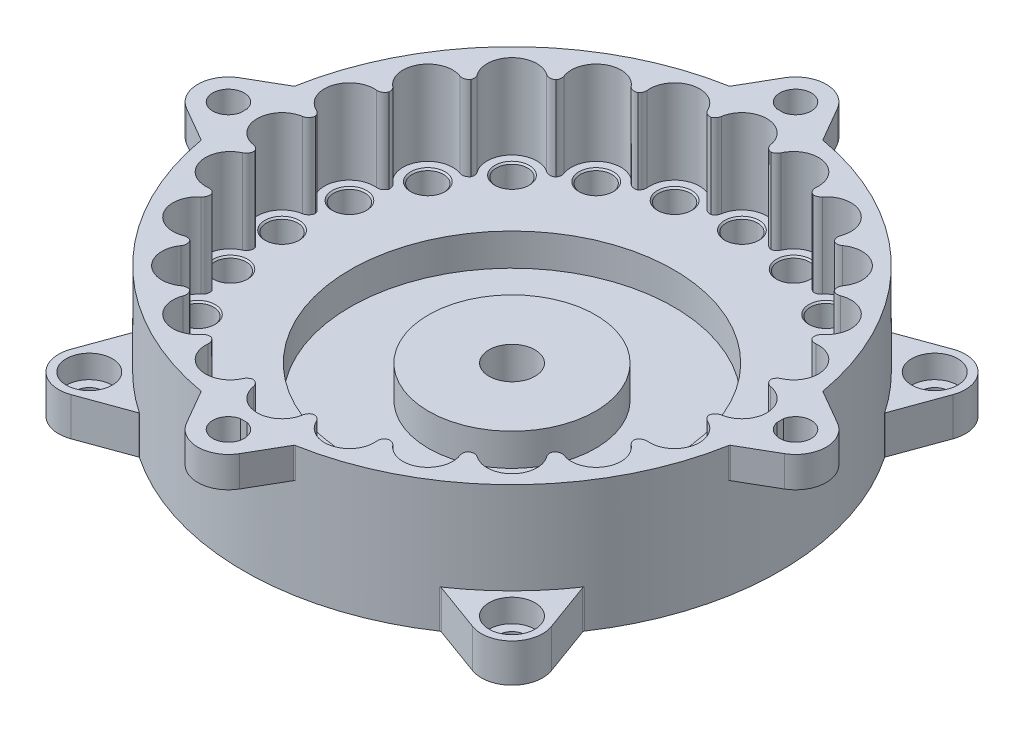
from build123d import *

# Parameters (mm, degrees)
SKETCH1_R                    = 35
BOSS_EXTRUDE2_DEPTH          = 6
SKETCH2_R                    = 35
SKETCH2_R_2                  = 30
BOSS_EXTRUDE3_DEPTH          = 11
SKETCH2_3_R                  = 3.25
CUT_EXTRUDE1_DEPTH           = 20
FILLET1_R                    = 1
CIRPATTERN1_START            = 6
CIRPATTERN1_DEPTH            = 11
SKETCH4_R                    = 21.1
SKETCH4_R_2                  = 16
SKETCH4_R_3                  = 10.9
CUT_EXTRUDE2_DEPTH           = 4.2
SKETCH5_R                    = 3
CUT_EXTRUDE3_DEPTH           = 51.705029496
SKETCH10_R                   = 2.05
CUT_EXTRUDE10_DEPTH          = 6
CHAMFER1_SIZE                = 0.2
BOSS_EXTRUDE19_START         = -4
BOSS_EXTRUDE19_DEPTH         = 4
CIRPATTERN9_COUNT            = 24
CHAMFER1_OF_CIRPATTERN9_SIZE = 0.2
SKETCH29_R                   = 3
BOSS_EXTRUDE22_DEPTH         = 5
SKETCH29_3_R                 = 3
SKETCH29_3_R_2               = 1.75
BOSS_EXTRUDE23_DEPTH         = 2
FILLET2_R                    = 0.2
FILLET3_R                    = 0.2
CIRPATTERN14_COUNT           = 4
FILLET2_OF_CIRPATTERN14_R    = 0.2
FILLET3_OF_CIRPATTERN14_R    = 0.2


# Read off the part's stored shape, not the designer's step: CirPattern1
with BuildPart() as part:
    # Sketch1 → Boss-Extrude2 (new body)
    with BuildSketch(Plane(origin=(0, 0, 0), x_dir=(1, 0, 0), z_dir=(0, 1, 0))):
        with Locations(Location((0, 0, 0), (0, 0, 270))):
            Circle(SKETCH1_R)
    extrude(amount=BOSS_EXTRUDE2_DEPTH)

    # Sketch2 → Boss-Extrude3 (add)
    with BuildSketch(Plane(origin=(0, 6, 0), x_dir=(1, 0, 0), z_dir=(0, 1, 0))):
        with Locations(Location((0, 0, 0), (0, 0, 270))):
            Circle(SKETCH2_R)
        with Locations(Location((0, 0, 0), (0, 0, 270))):
            Circle(SKETCH2_R_2, mode=Mode.SUBTRACT)
    extrude(amount=BOSS_EXTRUDE3_DEPTH)

    # Sketch2<3> → Cut-Extrude1 (cut)
    with BuildSketch(Plane(origin=(0, 6, 0), x_dir=(1, 0, 0), z_dir=(0, 1, 0))):
        with Locations((30, 0)):
            Circle(SKETCH2_3_R)
    extrude(amount=CUT_EXTRUDE1_DEPTH, mode=Mode.SUBTRACT)

    # Fillet1
    fillet1_edges = [part.edges().sort_by_distance(p)[0] for p in [
        (29.823958333, 11.5, 3.245228703),
        (29.823958333, 11.5, -3.245228703),
    ]]
    fillet(fillet1_edges, radius=FILLET1_R)

    # CirPattern1 outline → CirPattern1 (cut)
    with BuildSketch(Plane(origin=(0, 0, 0), x_dir=(1, 0, 0), z_dir=(0, 1, 0)).offset(CIRPATTERN1_START)):
        with BuildLine():
            ThreePointArc((28.641179927, 10.997094191), (28.161078608, 11.065313669), (27.769519624, 11.351377884))
            ThreePointArc((27.769519624, 11.351377884), (28.977774789, 7.764571353), (29.724798387, 4.054178196))
            ThreePointArc((29.724798387, 4.054178196), (29.920866307, 4.497696566), (30.302536507, 4.796827026))
            ThreePointArc((30.302536507, 4.796827026), (32.117033724, 8.60573325), (28.641179927, 10.997094191))
        make_face()
        with BuildLine():
            ThreePointArc((24.81899797, 18.035260133), (24.337599207, 17.976895723), (23.885343404, 18.151869614))
            ThreePointArc((23.885343404, 18.151869614), (26.050295402, 14.878914929), (27.769519624, 11.351377884))
            ThreePointArc((27.769519624, 11.351377884), (27.72502864, 11.972296223), (28.056486004, 12.499226054))
            ThreePointArc((28.056486004, 12.499226054), (28.786247622, 16.640655681), (24.81899797, 18.035260133))
        make_face()
        with BuildLine():
            ThreePointArc((19.305442316, 23.844352901), (18.855552638, 23.663382043), (18.373420503, 23.715341428))
            ThreePointArc((18.373420503, 23.715341428), (21.311706557, 21.114240778), (23.885343404, 18.151869614))
            ThreePointArc((23.885343404, 18.151869614), (23.681662922, 18.740115559), (23.865446674, 19.33487817))
            ThreePointArc((23.865446674, 19.33487817), (23.498461406, 23.52406821), (19.305442316, 23.844352901))
        make_face()
        with BuildLine():
            ThreePointArc((12.476252672, 28.028492424), (12.088531318, 27.737247981), (11.609379358, 27.662651914))
            ThreePointArc((11.609379358, 27.662651914), (15.120760129, 25.91066601), (18.373420503, 23.715341428))
            ThreePointArc((18.373420503, 23.715341428), (18.024431012, 24.230826991), (18.048016593, 24.852890292))
            ThreePointArc((18.048016593, 24.852890292), (16.609293879, 28.804354366), (12.476252672, 28.028492424))
        make_face()
        with BuildLine():
            ThreePointArc((4.796827026, 30.302536507), (4.497696566, 29.920866307), (4.054178196, 29.724798387))
            ThreePointArc((4.054178196, 29.724798387), (7.899358887, 28.941322174), (11.609379358, 27.662651914))
            ThreePointArc((11.609379358, 27.662651914), (11.138863915, 28.070247606), (11.000644008, 28.677219012))
            ThreePointArc((11.000644008, 28.677219012), (8.588230423, 32.121671374), (4.796827026, 30.302536507))
        make_face()
        with BuildLine():
            ThreePointArc((-3.209494454, 30.511512805), (-3.399648775, 30.065427042), (-3.77730851, 29.761248973))
            ThreePointArc((-3.77730851, 29.761248973), (0.139629392, 29.999675059), (4.054178196, 29.724798387))
            ThreePointArc((4.054178196, 29.724798387), (3.49420165, 29.996727234), (3.203595712, 30.547242647))
            ThreePointArc((3.203595712, 30.547242647), (-0.018106744, 33.249949561), (-3.209494454, 30.511512805))
        make_face()
        with BuildLine():
            ThreePointArc((-10.997094191, 28.641179927), (-11.065313669, 28.161078608), (-11.351377884, 27.769519624))
            ThreePointArc((-11.351377884, 27.769519624), (-7.629615616, 29.013599665), (-3.77730851, 29.761248973))
            ThreePointArc((-3.77730851, 29.761248973), (-4.388584683, 29.878979474), (-4.811772337, 30.335522178))
            ThreePointArc((-4.811772337, 30.335522178), (-8.623209967, 32.112298633), (-10.997094191, 28.641179927))
        make_face()
        with BuildLine():
            ThreePointArc((-18.035260133, 24.81899797), (-17.976895723, 24.337599207), (-18.151869614, 23.885343404))
            ThreePointArc((-18.151869614, 23.885343404), (-14.878914929, 26.050295402), (-11.351377884, 27.769519624))
            ThreePointArc((-11.351377884, 27.769519624), (-11.972296223, 27.72502864), (-12.499226054, 28.056486004))
            ThreePointArc((-12.499226054, 28.056486004), (-16.640655681, 28.786247622), (-18.035260133, 24.81899797))
        make_face()
        with BuildLine():
            ThreePointArc((-23.844352901, 19.305442316), (-23.663382043, 18.855552638), (-23.715341428, 18.373420503))
            ThreePointArc((-23.715341428, 18.373420503), (-21.114240778, 21.311706557), (-18.151869614, 23.885343404))
            ThreePointArc((-18.151869614, 23.885343404), (-18.740115559, 23.681662922), (-19.33487817, 23.865446674))
            ThreePointArc((-19.33487817, 23.865446674), (-23.52406821, 23.498461406), (-23.844352901, 19.305442316))
        make_face()
        with BuildLine():
            ThreePointArc((-28.028492424, 12.476252672), (-27.737247981, 12.088531318), (-27.662651914, 11.609379358))
            ThreePointArc((-27.662651914, 11.609379358), (-25.910666011, 15.120760129), (-23.715341428, 18.373420503))
            ThreePointArc((-23.715341428, 18.373420503), (-24.230826991, 18.024431012), (-24.852890292, 18.048016593))
            ThreePointArc((-24.852890292, 18.048016593), (-28.804354366, 16.609293879), (-28.028492424, 12.476252672))
        make_face()
        with BuildLine():
            ThreePointArc((-30.302536507, 4.796827026), (-29.920866307, 4.497696566), (-29.724798387, 4.054178196))
            ThreePointArc((-29.724798387, 4.054178196), (-28.941322174, 7.899358887), (-27.662651914, 11.609379358))
            ThreePointArc((-27.662651914, 11.609379358), (-28.070247606, 11.138863915), (-28.677219012, 11.000644008))
            ThreePointArc((-28.677219012, 11.000644008), (-32.121671374, 8.588230423), (-30.302536507, 4.796827026))
        make_face()
        with BuildLine():
            ThreePointArc((-30.511512805, -3.209494454), (-30.065427042, -3.399648775), (-29.761248973, -3.77730851))
            ThreePointArc((-29.761248973, -3.77730851), (-29.999675059, 0.139629392), (-29.724798387, 4.054178196))
            ThreePointArc((-29.724798387, 4.054178196), (-29.996727234, 3.49420165), (-30.547242647, 3.203595712))
            ThreePointArc((-30.547242647, 3.203595712), (-33.249949561, -0.018106744), (-30.511512805, -3.209494454))
        make_face()
        with BuildLine():
            ThreePointArc((-28.641179927, -10.997094191), (-28.161078608, -11.065313669), (-27.769519624, -11.351377884))
            ThreePointArc((-27.769519624, -11.351377884), (-29.013599665, -7.629615616), (-29.761248973, -3.77730851))
            ThreePointArc((-29.761248973, -3.77730851), (-29.878979474, -4.388584683), (-30.335522178, -4.811772337))
            ThreePointArc((-30.335522178, -4.811772337), (-32.112298633, -8.623209967), (-28.641179927, -10.997094191))
        make_face()
        with BuildLine():
            ThreePointArc((-24.81899797, -18.035260133), (-24.337599207, -17.976895723), (-23.885343404, -18.151869614))
            ThreePointArc((-23.885343404, -18.151869614), (-26.050295402, -14.878914929), (-27.769519624, -11.351377884))
            ThreePointArc((-27.769519624, -11.351377884), (-27.72502864, -11.972296223), (-28.056486004, -12.499226054))
            ThreePointArc((-28.056486004, -12.499226054), (-28.786247622, -16.640655681), (-24.81899797, -18.035260133))
        make_face()
        with BuildLine():
            ThreePointArc((-19.305442316, -23.844352901), (-18.855552638, -23.663382043), (-18.373420503, -23.715341428))
            ThreePointArc((-18.373420503, -23.715341428), (-21.311706557, -21.114240778), (-23.885343404, -18.151869614))
            ThreePointArc((-23.885343404, -18.151869614), (-23.681662922, -18.740115559), (-23.865446674, -19.33487817))
            ThreePointArc((-23.865446674, -19.33487817), (-23.498461406, -23.52406821), (-19.305442316, -23.844352901))
        make_face()
        with BuildLine():
            ThreePointArc((-12.476252672, -28.028492424), (-12.088531318, -27.737247981), (-11.609379358, -27.662651914))
            ThreePointArc((-11.609379358, -27.662651914), (-15.120760129, -25.91066601), (-18.373420503, -23.715341428))
            ThreePointArc((-18.373420503, -23.715341428), (-18.024431012, -24.230826991), (-18.048016593, -24.852890292))
            ThreePointArc((-18.048016593, -24.852890292), (-16.609293879, -28.804354366), (-12.476252672, -28.028492424))
        make_face()
        with BuildLine():
            ThreePointArc((-4.796827026, -30.302536507), (-4.497696566, -29.920866307), (-4.054178196, -29.724798387))
            ThreePointArc((-4.054178196, -29.724798387), (-7.899358887, -28.941322174), (-11.609379358, -27.662651914))
            ThreePointArc((-11.609379358, -27.662651914), (-11.138863915, -28.070247606), (-11.000644008, -28.677219012))
            ThreePointArc((-11.000644008, -28.677219012), (-8.588230423, -32.121671374), (-4.796827026, -30.302536507))
        make_face()
        with BuildLine():
            ThreePointArc((3.209494454, -30.511512805), (3.399648775, -30.065427042), (3.77730851, -29.761248973))
            ThreePointArc((3.77730851, -29.761248973), (-0.139629392, -29.999675059), (-4.054178196, -29.724798387))
            ThreePointArc((-4.054178196, -29.724798387), (-3.49420165, -29.996727234), (-3.203595712, -30.547242647))
            ThreePointArc((-3.203595712, -30.547242647), (0.018106744, -33.249949561), (3.209494454, -30.511512805))
        make_face()
        with BuildLine():
            ThreePointArc((10.997094191, -28.641179927), (11.065313669, -28.161078608), (11.351377884, -27.769519624))
            ThreePointArc((11.351377884, -27.769519624), (7.629615616, -29.013599665), (3.77730851, -29.761248973))
            ThreePointArc((3.77730851, -29.761248973), (4.388584683, -29.878979474), (4.811772337, -30.335522178))
            ThreePointArc((4.811772337, -30.335522178), (8.623209967, -32.112298633), (10.997094191, -28.641179927))
        make_face()
        with BuildLine():
            ThreePointArc((18.035260133, -24.81899797), (17.976895723, -24.337599207), (18.151869614, -23.885343404))
            ThreePointArc((18.151869614, -23.885343404), (14.878914929, -26.050295402), (11.351377884, -27.769519624))
            ThreePointArc((11.351377884, -27.769519624), (11.972296223, -27.72502864), (12.499226054, -28.056486004))
            ThreePointArc((12.499226054, -28.056486004), (16.640655681, -28.786247622), (18.035260133, -24.81899797))
        make_face()
        with BuildLine():
            ThreePointArc((23.844352901, -19.305442316), (23.663382043, -18.855552638), (23.715341428, -18.373420503))
            ThreePointArc((23.715341428, -18.373420503), (21.114240778, -21.311706557), (18.151869614, -23.885343404))
            ThreePointArc((18.151869614, -23.885343404), (18.740115559, -23.681662922), (19.33487817, -23.865446674))
            ThreePointArc((19.33487817, -23.865446674), (23.52406821, -23.498461406), (23.844352901, -19.305442316))
        make_face()
        with BuildLine():
            ThreePointArc((28.028492424, -12.476252672), (27.737247981, -12.088531318), (27.662651914, -11.609379358))
            ThreePointArc((27.662651914, -11.609379358), (25.91066601, -15.120760129), (23.715341428, -18.373420503))
            ThreePointArc((23.715341428, -18.373420503), (24.230826991, -18.024431012), (24.852890292, -18.048016593))
            ThreePointArc((24.852890292, -18.048016593), (28.804354366, -16.609293879), (28.028492424, -12.476252672))
        make_face()
        with BuildLine():
            ThreePointArc((28.677219012, -11.000644008), (32.121671374, -8.588230423), (30.302536507, -4.796827026))
            ThreePointArc((30.302536507, -4.796827026), (29.920866307, -4.497696566), (29.724798387, -4.054178196))
            ThreePointArc((29.724798387, -4.054178196), (28.941322174, -7.899358887), (27.662651914, -11.609379358))
            ThreePointArc((27.662651914, -11.609379358), (28.070247606, -11.138863915), (28.677219012, -11.000644008))
        make_face()
    extrude(amount=CIRPATTERN1_DEPTH, mode=Mode.SUBTRACT)

    # Sketch4 → Cut-Extrude2 (cut)
    # profile 1 of 2: a face of its own
    with BuildSketch(Plane(origin=(0, 6, 0), x_dir=(1, 0, 0), z_dir=(0, 1, 0))):
        with Locations(Location((0, 0, 0), (0, 0, 270))):
            Circle(SKETCH4_R)
        Circle(SKETCH4_R_2, mode=Mode.SUBTRACT)
    # profile 2 of 2: a face of its own
    with BuildSketch(Plane(origin=(0, 6, 0), x_dir=(1, 0, 0), z_dir=(0, 1, 0))):
        Circle(SKETCH4_R_2)
        with Locations(Location((0, 0, 0), (0, 0, 270))):
            Circle(SKETCH4_R_3, mode=Mode.SUBTRACT)
    extrude(amount=-CUT_EXTRUDE2_DEPTH, mode=Mode.SUBTRACT)

    # Sketch5 → Cut-Extrude3 (cut, through all)
    with BuildSketch(Plane(origin=(0, 6, 0), x_dir=(1, 0, 0), z_dir=(0, 1, 0))):
        with Locations(Location((0, 0, 0), (0, 0, 270))):
            Circle(SKETCH5_R)
    extrude(amount=-CUT_EXTRUDE3_DEPTH, mode=Mode.SUBTRACT)

    # Sketch10 → Cut-Extrude10 (cut)
    with BuildSketch(Plane(origin=(0, 6, 0), x_dir=(1, 0, 0), z_dir=(0, 1, 0))):
        with Locations(Location((30, 0, 0), (0, 0, 270))):
            Circle(SKETCH10_R)
    cut_extrude10 = extrude(amount=-CUT_EXTRUDE10_DEPTH, mode=Mode.SUBTRACT)

    # Chamfer1
    chamfer1_edges = [part.edges().sort_by_distance(p)[0] for p in [
        (30, 6, -2.05),
    ]]
    chamfer(chamfer1_edges, length=CHAMFER1_SIZE)

    # Sketch23 → Boss-Extrude19 (add)
    with BuildSketch(Plane(origin=(0, 17, 0), x_dir=(1, 0, 0), z_dir=(0, 1, 0)).offset(BOSS_EXTRUDE19_START)):
        with BuildLine():
            ThreePointArc((34.467719526, 6.080814967), (34.846911854, 3.269974658), (34.997263514, 0.437660331))
            ThreePointArc((34.997263514, 0.437660331), (39.05, 0), (34.997263514, -0.437660331))
            ThreePointArc((34.997263514, -0.437660331), (34.846911854, -3.269974658), (34.467719526, -6.080814967))
            Line((34.467719526, -6.080814967), (39, -3.464101615))
            ThreePointArc((39, -3.464101615), (41, 0), (39, 3.464101615))
            Line((39, 3.464101615), (34.467719526, 6.080814967))
        make_face()
    boss_extrude19 = extrude(amount=BOSS_EXTRUDE19_DEPTH)

    # CirPattern9: Cut-Extrude10 ×24 about axis
    cirpattern9_axis = Axis((0, 0, 0), (0, 1, 0))
    for i in range(1, CIRPATTERN9_COUNT):
        add(cut_extrude10.rotate(cirpattern9_axis, i * 360 / CIRPATTERN9_COUNT), mode=Mode.SUBTRACT)

    # Chamfer1 of CirPattern9
    chamfer1_of_cirpattern9_edges = [part.edges().sort_by_distance(p)[0] for p in [
        (28.447195746, 6, -9.744719297),
        (24.955762114, 6, -16.775352078),
        (19.763634534, 6, -22.662772337),
        (13.224647922, 6, -27.005762114),
        (5.784423409, 6, -29.508353831),
        (-2.05, 6, -30),
        (-9.744719297, 6, -28.447195746),
        (-16.775352078, 6, -24.955762114),
        (-22.662772337, 6, -19.763634534),
        (-27.005762114, 6, -13.224647922),
        (-29.508353831, 6, -5.784423409),
        (-30, 6, 2.05),
        (-28.447195746, 6, 9.744719297),
        (-24.955762114, 6, 16.775352078),
        (-19.763634534, 6, 22.662772337),
        (-13.224647922, 6, 27.005762114),
        (-5.784423409, 6, 29.508353831),
        (2.05, 6, 30),
        (9.744719297, 6, 28.447195746),
        (16.775352078, 6, 24.955762114),
        (22.662772337, 6, 19.763634534),
        (27.005762114, 6, 13.224647922),
        (29.508353831, 6, 5.784423409),
    ]]
    chamfer(chamfer1_of_cirpattern9_edges, length=CHAMFER1_OF_CIRPATTERN9_SIZE)

    # Sketch29 → Boss-Extrude22 (add)
    with BuildSketch(Plane.XZ):
        with BuildLine():
            ThreePointArc((19.664153078, 28.953774948), (24.748737342, 24.748737342), (28.953774948, 19.664153078))
            Line((28.953774948, 19.664153078), (31.335934949, 26.209083893))
            ThreePointArc((31.335934949, 26.209083893), (30.405591591, 30.405591591), (26.209083893, 31.335934949))
            Line((26.209083893, 31.335934949), (19.664153078, 28.953774948))
        make_face()
        with Locations(Location((27.577164466, 27.577164466, 0), (0, 0, 270))):
            Circle(SKETCH29_R, mode=Mode.SUBTRACT)
    boss_extrude22 = extrude(amount=-BOSS_EXTRUDE22_DEPTH)

    # Sketch29<3> → Boss-Extrude23 (add)
    with BuildSketch(Plane.XZ):
        with Locations(Location((27.577164466, 27.577164466, 0), (0, 0, 270))):
            Circle(SKETCH29_3_R)
        with Locations(Location((27.577164466, 27.577164466, 0), (0, 0, 270))):
            Circle(SKETCH29_3_R_2, mode=Mode.SUBTRACT)
    boss_extrude23 = extrude(amount=-BOSS_EXTRUDE23_DEPTH)

    # Fillet2
    fillet2_edges = [part.edges().sort_by_distance(p)[0] for p in [
        (28.953774948, 2.5, 19.664153078),
        (19.664153078, 2.5, 28.953774948),
    ]]
    fillet(fillet2_edges, radius=FILLET2_R)

    # Fillet3
    fillet3_edges = [part.edges().sort_by_distance(p)[0] for p in [
        (34.467719526, 15, 6.080814967),
        (34.467719526, 15, -6.080814967),
    ]]
    fillet(fillet3_edges, radius=FILLET3_R)

    # CirPattern14: Boss-Extrude19, Boss-Extrude22, Boss-Extrude23 ×4 about axis
    cirpattern14_axis = Axis((0, 0, 0), (0, 1, 0))
    add([boss_extrude19.rotate(cirpattern14_axis, i * 360 / CIRPATTERN14_COUNT) for i in range(1, CIRPATTERN14_COUNT)])
    add([boss_extrude22.rotate(cirpattern14_axis, i * 360 / CIRPATTERN14_COUNT) for i in range(1, CIRPATTERN14_COUNT)])
    add([boss_extrude23.rotate(cirpattern14_axis, i * 360 / CIRPATTERN14_COUNT) for i in range(1, CIRPATTERN14_COUNT)])

    # Fillet2 of CirPattern14
    fillet2_of_cirpattern14_edges = [part.edges().sort_by_distance(p)[0] for p in [
        (19.664153078, 2.5, -28.953774948),
        (28.953774948, 2.5, -19.664153078),
        (-28.953774948, 2.5, -19.664153078),
        (-19.664153078, 2.5, -28.953774948),
        (-19.664153078, 2.5, 28.953774948),
        (-28.953774948, 2.5, 19.664153078),
    ]]
    fillet(fillet2_of_cirpattern14_edges, radius=FILLET2_OF_CIRPATTERN14_R)

    # Fillet3 of CirPattern14
    fillet3_of_cirpattern14_edges = [part.edges().sort_by_distance(p)[0] for p in [
        (6.080814967, 15, -34.467719526),
        (-6.080814967, 15, -34.467719526),
        (-34.467719526, 15, -6.080814967),
        (-34.467719526, 15, 6.080814967),
        (-6.080814967, 15, 34.467719526),
        (6.080814967, 15, 34.467719526),
    ]]
    fillet(fillet3_of_cirpattern14_edges, radius=FILLET3_OF_CIRPATTERN14_R)


solid = part.part
